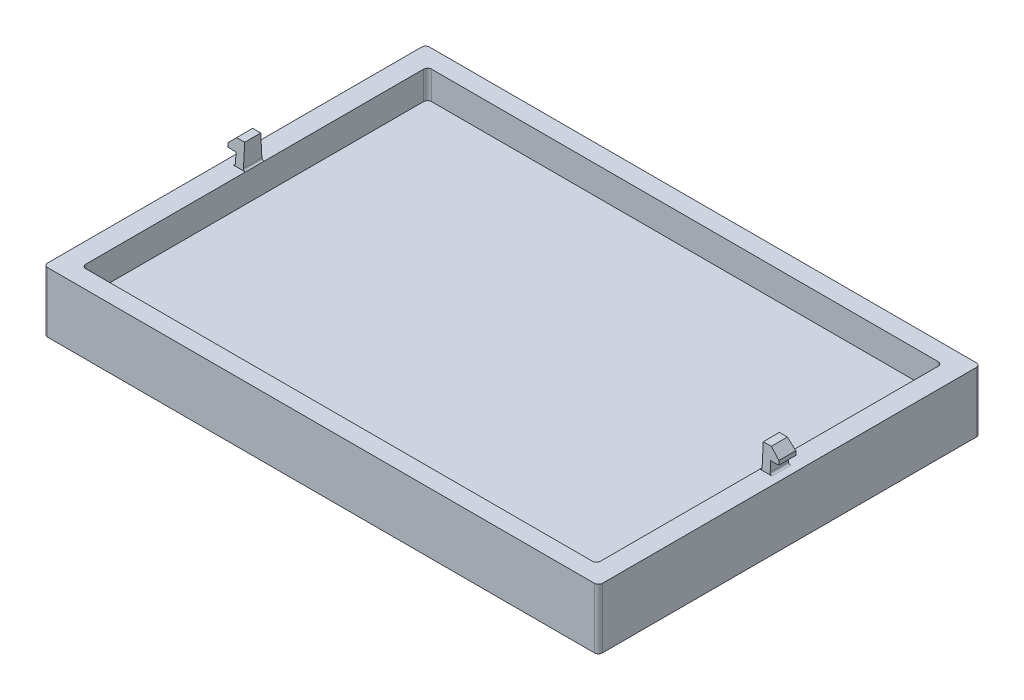
from build123d import *

# Parameters (mm, degrees)
SKETCH1_W           = 138
SKETCH1_H           = 95
BOSS_EXTRUDE1_DEPTH = 15
SKETCH2_W           = 128
SKETCH2_H           = 86
CUT_EXTRUDE1_DEPTH  = 7
SNAP_START          = 64.5
SNAP_HOOK2_DEPTH    = 2
SNAP_HOOK2_2_DEPTH  = 2
FILLET1_R           = 1
FILLET2_R           = 0.5
SCALE1_SCALE        = 0.4


with BuildPart() as part:
    # Sketch1 → Boss-Extrude1 (new body)
    with BuildSketch(Plane(origin=(0, 0, 0), x_dir=(1, 0, 0), z_dir=(0, 1, 0))):
        Rectangle(SKETCH1_W, SKETCH1_H)
    extrude(amount=BOSS_EXTRUDE1_DEPTH)

    # Sketch2 → Cut-Extrude1 (cut)
    with BuildSketch(Plane(origin=(0, 15, 0), x_dir=(1, 0, 0), z_dir=(0, 1, 0))):
        Rectangle(SKETCH2_W, SKETCH2_H)
    extrude(amount=-CUT_EXTRUDE1_DEPTH, mode=Mode.SUBTRACT)



with BuildPart() as body_2:
    # Snap Hook2: read off the stored shape, not the designer's step
    # Snap Hook2 outline → Snap Hook2 (new body)
    with BuildSketch(Plane.YZ.offset(SNAP_START)):
        Polygon((21, -2), (21, 2), (18, 2.157223338), (18, -2.157223338), align=None)
    snap_hook2 = extrude(amount=SNAP_HOOK2_DEPTH)


with BuildPart() as part_1:
    add(part.part)

    add(body_2.part)  # Snap Hook2 2 merges body 2
    # Snap Hook2 2 outline → Snap Hook2 2 (add)
    with BuildSketch(Plane.YZ.offset(SNAP_START)):
        Polygon((18, -2.157223338), (18, 2.157223338), (15, 2.314446676), (15, -2.314446676), align=None)
    snap_hook2_2 = extrude(amount=SNAP_HOOK2_2_DEPTH)

    # Snap Hook2 3: loft between two sections, ruled curve by curve
    snap_hook2_3_from = [
        Edge.make_line((66.5, 21, -2), (66.5, 21, 2)),
        Edge.make_line((66.5, 18, 2.157223338), (66.5, 18, -2.157223338)),
        Edge.make_line((66.5, 18, 2.157223338), (66.5, 21, 2)),
        Edge.make_line((66.5, 18, -2.157223338), (66.5, 21, -2)),
    ]
    snap_hook2_3_to = [
        Edge.make_line((68.5, 19, -2.104815559), (68.5, 19, 2.104815559)),
        Edge.make_line((68.5, 18, 2.157223338), (68.5, 18, -2.157223338)),
        Edge.make_line((68.5, 18, 2.157223338), (68.5, 19, 2.104815559)),
        Edge.make_line((68.5, 18, -2.157223338), (68.5, 19, -2.104815559)),
    ]
    snap_hook2_3 = Solid(Shell([*[Face.make_surface_from_curves(snap_hook2_3_from[k], snap_hook2_3_to[k]) for k in range(4)], Face(Wire(snap_hook2_3_from)), Face(Wire(snap_hook2_3_to))]))
    add(snap_hook2_3)

    # Fillet1
    fillet1_edges = [part_1.edges().sort_by_distance(p)[0] for p in [
        (64, 11.5, -43),
        (64, 11.5, 43),
        (-64, 11.5, 43),
        (-64, 11.5, -43),
        (-69, 7.5, -47.5),
        (69, 7.5, -47.5),
        (69, 7.5, 47.5),
        (-69, 7.5, 47.5),
    ]]
    fillet(fillet1_edges, radius=FILLET1_R)

    # Mirror1: Snap Hook2, Snap Hook2 2, Snap Hook2 3 across plane
    add(snap_hook2.mirror(Plane(origin=(0, 0, 0), x_dir=(0, 0, 1), z_dir=(1, 0, 0))))
    add(snap_hook2_2.mirror(Plane(origin=(0, 0, 0), x_dir=(0, 0, 1), z_dir=(1, 0, 0))))
    add(snap_hook2_3.mirror(Plane(origin=(0, 0, 0), x_dir=(0, 0, 1), z_dir=(1, 0, 0))))

    # Fillet2
    fillet2_edges = [part_1.edges().sort_by_distance(p)[0] for p in [
        (66.5, 15, 0),
        (64.5, 15, 0),
        (-66.5, 15, 0),
        (-64.5, 15, 0),
    ]]
    fillet(fillet2_edges, radius=FILLET2_R - 0.0001)  # a hair under: the kernel refuses the full size


with BuildPart() as part_2:
    # Scale1: scaled about (0, 4.938102716, 0)
    add(part_1.part.scale(SCALE1_SCALE).moved(Location((0, 2.96286163, 0))))


solid = part_2.part
